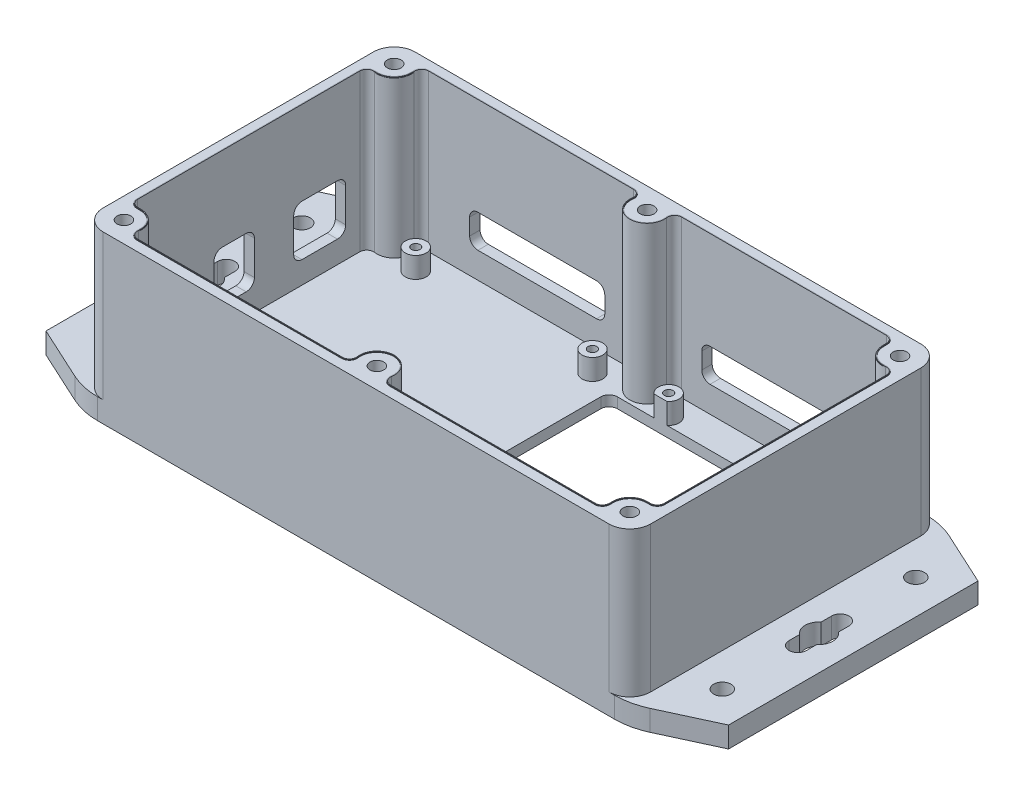
from build123d import *

# Parameters (mm, degrees)
SKETCH1_W           = 158
SKETCH1_H           = 90
BOSS_EXTRUDE1_DEPTH = 48
BOSS_EXTRUDE2_DEPTH = 6
HOLE2_D             = 5
CUT_EXTRUDE1_DEPTH  = 187.622613849
SHELL1_START        = 3
SHELL1_OUTLINE_W    = 45
SHELL1_OUTLINE_H    = 84
SHELL1_DEPTH        = 152
SKETCH7_R           = 5
BOSS_EXTRUDE3_DEPTH = 45
HOLE1_D             = 4
HOLE1_CBORE_D       = 7.5
HOLE1_CBORE_DEPTH   = 42
FILLET3_R           = 2
EXTRUDE_THIN1_DEPTH = 0.2
SKETCH12_R          = 3
BOSS_EXTRUDE4_DEPTH = 6
HOLE3_D             = 2.5
HOLE3_DEPTH         = 6
FILLET1_R           = 6
FILLET2_R           = 20
CUT_EXTRUDE2_REACH  = 206.767
SKETCH15_W          = 80.645
SKETCH15_H          = 53.25
FILLET4_R           = 2.38125
CUT_EXTRUDE3_REACH  = 206.767
SKETCH16_W          = 15
SKETCH16_H          = 14.6
SKETCH16_W_2        = 11.65
SKETCH16_W_3        = 9
SKETCH16_H_2        = 12.1
FILLET5_R           = 2.38125
CUT_EXTRUDE4_REACH  = 206.767
SKETCH17_W          = 46
SKETCH17_H          = 9.5
SKETCH17_W_2        = 39
FILLET6_R           = 2.38125


# Read off the part's stored shape, not the designer's step: Shell1
with BuildPart() as part:
    # Sketch1 → Boss-Extrude1 (new body)
    with BuildSketch(Plane(origin=(0, 0, 0), x_dir=(1, 0, 0), z_dir=(0, 1, 0))):
        with Locations((79, 45)):
            Rectangle(SKETCH1_W, SKETCH1_H)
    extrude(amount=BOSS_EXTRUDE1_DEPTH)

    # Sketch2 → Boss-Extrude2 (add)
    with BuildSketch(Plane.XZ):
        Polygon((-19.5, -9), (0, 0), (0, -90), (-19.5, -81), align=None)
    boss_extrude2 = extrude(amount=-BOSS_EXTRUDE2_DEPTH)

    # Hole2 (through all)
    with Locations(Plane(origin=(0, 6, 0), x_dir=(1, 0, 0), z_dir=(0, 1, 0))):
        with Locations((-9.62, 72.925), (-9.62, 17.075)):
            hole2 = Hole(HOLE2_D / 2)

    # Sketch10 → Cut-Extrude1 (cut, through all)
    with BuildSketch(Plane(origin=(0, 6, 0), x_dir=(1, 0, 0), z_dir=(0, 1, 0))):
        with BuildLine():
            Line((-12.12, 51.15), (-12.12, 48.122498999))
            ThreePointArc((-12.12, 48.122498999), (-13.62, 45), (-12.12, 41.877501001))
            Line((-12.12, 41.877501001), (-12.12, 38.85))
            ThreePointArc((-12.12, 38.85), (-9.62, 36.35), (-7.12, 38.85))
            Line((-7.12, 38.85), (-7.12, 41.877501001))
            ThreePointArc((-7.12, 41.877501001), (-5.62, 45), (-7.12, 48.122498999))
            Line((-7.12, 48.122498999), (-7.12, 51.15))
            ThreePointArc((-7.12, 51.15), (-9.62, 53.65), (-12.12, 51.15))
        make_face()
    cut_extrude1 = extrude(amount=-CUT_EXTRUDE1_DEPTH, mode=Mode.SUBTRACT)

    # Shell1 outline → Shell1 (cut)
    with BuildSketch(Plane.YZ.offset(SHELL1_START)):
        with Locations((25.5, -45)):
            Rectangle(SHELL1_OUTLINE_W, SHELL1_OUTLINE_H)
    extrude(amount=SHELL1_DEPTH, mode=Mode.SUBTRACT)

    # Sketch7 → Boss-Extrude3 (add)
    with BuildSketch(Plane(origin=(0, 3, 0), x_dir=(1, 0, 0), z_dir=(0, 1, 0))):
        with Locations((79, 84)):
            Circle(SKETCH7_R)
        with Locations((6, 84)):
            Circle(SKETCH7_R)
        with Locations((6, 6)):
            Circle(SKETCH7_R)
        with Locations((79, 6)):
            Circle(SKETCH7_R)
        with Locations((152, 6)):
            Circle(SKETCH7_R)
        with Locations((152, 84)):
            Circle(SKETCH7_R)
    extrude(amount=BOSS_EXTRUDE3_DEPTH)

    # Mirror1: Boss-Extrude2, Hole2, Cut-Extrude1 across plane
    add(boss_extrude2.mirror(Plane(origin=(79, 0, 0), x_dir=(0, 0, 1), z_dir=(1, 0, 0))))
    add(hole2.mirror(Plane(origin=(79, 0, 0), x_dir=(0, 0, 1), z_dir=(1, 0, 0))), mode=Mode.SUBTRACT)
    add(cut_extrude1.mirror(Plane(origin=(79, 0, 0), x_dir=(0, 0, 1), z_dir=(1, 0, 0))), mode=Mode.SUBTRACT)

    # Hole1 (through all)
    with Locations(Plane(origin=(0, 0, 0), x_dir=(-1, 0, 0), z_dir=(0, -1, 0))):
        with Locations((-152, 84), (-152, 6), (-79, 84), (-79, 6), (-6, 84), (-6, 6)):
            CounterBoreHole(HOLE1_D / 2, HOLE1_CBORE_D / 2, HOLE1_CBORE_DEPTH)

    # Fillet3
    fillet3_edges = [part.edges().sort_by_distance(p)[0] for p in [
        (3, 25.5, -80),
        (10, 25.5, -87),
        (10, 25.5, -3),
        (3, 25.5, -10),
        (83, 25.5, -3),
        (75, 25.5, -3),
        (155, 25.5, -10),
        (148, 25.5, -3),
        (155, 25.5, -80),
        (148, 25.5, -87),
        (75, 25.5, -87),
        (83, 25.5, -87),
    ]]
    fillet(fillet3_edges, radius=FILLET3_R)

    # Sketch11 → Extrude-Thin1 (add)
    with BuildSketch(Plane(origin=(0, 48, 0), x_dir=(1, 0, 0), z_dir=(0, 1, 0))):
        with BuildLine():
            ThreePointArc((83.750767929, 5.314285714), (79, 10.8), (74.249232071, 5.314285714))
            ThreePointArc((74.249232071, 5.314285714), (73.734840451, 3.559761924), (72.07179677, 2.8))
            Line((72.07179677, 2.8), (12.92820323, 2.8))
            ThreePointArc((12.92820323, 2.8), (11.372568312, 3.444365081), (10.72820323, 5))
            Line((10.72820323, 5), (10.72820323, 5.92820323))
            ThreePointArc((10.72820323, 5.92820323), (9.32231578, 9.32231578), (5.92820323, 10.72820323))
            Line((5.92820323, 10.72820323), (5, 10.72820323))
            ThreePointArc((5, 10.72820323), (3.444365081, 11.372568312), (2.8, 12.92820323))
            Line((2.8, 12.92820323), (2.8, 77.07179677))
            ThreePointArc((2.8, 77.07179677), (3.444365081, 78.627431688), (5, 79.27179677))
            Line((5, 79.27179677), (5.92820323, 79.27179677))
            ThreePointArc((5.92820323, 79.27179677), (9.32231578, 80.67768422), (10.72820323, 84.07179677))
            Line((10.72820323, 84.07179677), (10.72820323, 85))
            ThreePointArc((10.72820323, 85), (11.372568312, 86.555634919), (12.92820323, 87.2))
            Line((12.92820323, 87.2), (72.07179677, 87.2))
            ThreePointArc((72.07179677, 87.2), (73.734840451, 86.440238076), (74.249232071, 84.685714286))
            ThreePointArc((74.249232071, 84.685714286), (79, 79.2), (83.750767929, 84.685714286))
            ThreePointArc((83.750767929, 84.685714286), (84.265159549, 86.440238076), (85.92820323, 87.2))
            Line((85.92820323, 87.2), (145.07179677, 87.2))
            ThreePointArc((145.07179677, 87.2), (146.627431688, 86.555634919), (147.27179677, 85))
            Line((147.27179677, 85), (147.27179677, 84.07179677))
            ThreePointArc((147.27179677, 84.07179677), (148.67768422, 80.67768422), (152.07179677, 79.27179677))
            Line((152.07179677, 79.27179677), (153, 79.27179677))
            ThreePointArc((153, 79.27179677), (154.555634919, 78.627431688), (155.2, 77.07179677))
            Line((155.2, 77.07179677), (155.2, 12.92820323))
            ThreePointArc((155.2, 12.92820323), (154.555634919, 11.372568312), (153, 10.72820323))
            Line((153, 10.72820323), (152.07179677, 10.72820323))
            ThreePointArc((152.07179677, 10.72820323), (148.67768422, 9.32231578), (147.27179677, 5.92820323))
            Line((147.27179677, 5.92820323), (147.27179677, 5))
            ThreePointArc((147.27179677, 5), (146.627431688, 3.444365081), (145.07179677, 2.8))
            Line((145.07179677, 2.8), (85.92820323, 2.8))
            ThreePointArc((85.92820323, 2.8), (84.265159549, 3.559761924), (83.750767929, 5.314285714))
        make_face()
        with BuildLine():
            ThreePointArc((83.948716593, 5.285714286), (79, 11), (74.051283407, 5.285714286))
            ThreePointArc((74.051283407, 5.285714286), (73.583654662, 3.690692659), (72.07179677, 3))
            Line((72.07179677, 3), (12.92820323, 3))
            ThreePointArc((12.92820323, 3), (11.513989668, 3.585786438), (10.92820323, 5))
            Line((10.92820323, 5), (10.92820323, 5.92820323))
            ThreePointArc((10.92820323, 5.92820323), (9.463737136, 9.463737136), (5.92820323, 10.92820323))
            Line((5.92820323, 10.92820323), (5, 10.92820323))
            ThreePointArc((5, 10.92820323), (3.585786438, 11.513989668), (3, 12.92820323))
            Line((3, 12.92820323), (3, 77.07179677))
            ThreePointArc((3, 77.07179677), (3.585786438, 78.486010332), (5, 79.07179677))
            Line((5, 79.07179677), (5.92820323, 79.07179677))
            ThreePointArc((5.92820323, 79.07179677), (9.463737136, 80.536262864), (10.92820323, 84.07179677))
            Line((10.92820323, 84.07179677), (10.92820323, 85))
            ThreePointArc((10.92820323, 85), (11.513989668, 86.414213562), (12.92820323, 87))
            Line((12.92820323, 87), (72.07179677, 87))
            ThreePointArc((72.07179677, 87), (73.583654662, 86.309307341), (74.051283407, 84.714285714))
            ThreePointArc((74.051283407, 84.714285714), (79, 79), (83.948716593, 84.714285714))
            ThreePointArc((83.948716593, 84.714285714), (84.416345338, 86.309307341), (85.92820323, 87))
            Line((85.92820323, 87), (145.07179677, 87))
            ThreePointArc((145.07179677, 87), (146.486010332, 86.414213562), (147.07179677, 85))
            Line((147.07179677, 85), (147.07179677, 84.07179677))
            ThreePointArc((147.07179677, 84.07179677), (148.536262864, 80.536262864), (152.07179677, 79.07179677))
            Line((152.07179677, 79.07179677), (153, 79.07179677))
            ThreePointArc((153, 79.07179677), (154.414213562, 78.486010332), (155, 77.07179677))
            Line((155, 77.07179677), (155, 12.92820323))
            ThreePointArc((155, 12.92820323), (154.414213562, 11.513989668), (153, 10.92820323))
            Line((153, 10.92820323), (152.07179677, 10.92820323))
            ThreePointArc((152.07179677, 10.92820323), (148.536262864, 9.463737136), (147.07179677, 5.92820323))
            Line((147.07179677, 5.92820323), (147.07179677, 5))
            ThreePointArc((147.07179677, 5), (146.486010332, 3.585786438), (145.07179677, 3))
            Line((145.07179677, 3), (85.92820323, 3))
            ThreePointArc((85.92820323, 3), (84.416345338, 3.690692659), (83.948716593, 5.285714286))
        make_face(mode=Mode.SUBTRACT)
    extrude(amount=EXTRUDE_THIN1_DEPTH)

    # Sketch12 → Boss-Extrude4 (add)
    with BuildSketch(Plane(origin=(0, 3, 0), x_dir=(1, 0, 0), z_dir=(0, 1, 0))):
        with Locations(Location((15.87241909, 80.35, 0), (0, 0, 90))):
            Circle(SKETCH12_R)
        with Locations(Location((66.87241909, 80.35, 0), (0, 0, 90))):
            Circle(SKETCH12_R)
        with Locations(Location((140.62241909, 80.35, 0), (0, 0, 90))):
            Circle(SKETCH12_R)
        with Locations(Location((88.87241909, 80.35, 0), (0, 0, 90))):
            Circle(SKETCH12_R)
        with Locations(Location((66.87241909, 9.65, 0), (0, 0, 90))):
            Circle(SKETCH12_R)
        with Locations(Location((15.87241909, 9.65, 0), (0, 0, 90))):
            Circle(SKETCH12_R)
        with Locations(Location((88.87241909, 9.65, 0), (0, 0, 90))):
            Circle(SKETCH12_R)
        with Locations(Location((140.62241909, 9.65, 0), (0, 0, 90))):
            Circle(SKETCH12_R)
        with Locations(Location((93.060693078, 19.233989691, 0), (0, 0, 90))):
            Circle(SKETCH12_R)
        with Locations(Location((133.760693078, 19.233989691, 0), (0, 0, 90))):
            Circle(SKETCH12_R)
    extrude(amount=BOSS_EXTRUDE4_DEPTH)

    # Hole3
    with Locations(Plane(origin=(0, 9, 0), x_dir=(1, 0, 0), z_dir=(0, 1, 0))):
        with Locations((15.87241909, 80.35), (66.87241909, 80.35), (88.87241909, 80.35), (140.62241909, 80.35), (133.760693078, 19.233989691), (93.060693078, 19.233989691), (140.62241909, 9.65), (88.87241909, 9.65), (66.87241909, 9.65), (15.87241909, 9.65)):
            Hole(HOLE3_D / 2, depth=HOLE3_DEPTH)

    # Fillet1
    fillet1_edges = [part.edges().sort_by_distance(p)[0] for p in [
        (0, 27, 0),
        (0, 27, -90),
        (158, 27, 0),
        (158, 27, -90),
    ]]
    fillet(fillet1_edges, radius=FILLET1_R)

    # Fillet2
    fillet2_edges = [part.edges().sort_by_distance(p)[0] for p in [
        (158, 3, -90),
        (158, 3, 0),
        (0, 3, -90),
        (0, 3, 0),
    ]]
    fillet(fillet2_edges, radius=FILLET2_R)

    # Sketch15 → Cut-Extrude2 (cut, up to next)
    with BuildSketch(Plane.XZ, mode=Mode.PRIVATE) as cut_extrude2_sk1:
        with Locations((114.34, -51.375)):
            Rectangle(SKETCH15_W, SKETCH15_H)
    cut_extrude2_tool1 = extrude(cut_extrude2_sk1.sketch, amount=-CUT_EXTRUDE2_REACH, mode=Mode.PRIVATE) & part.part
    add(cut_extrude2_tool1.solids().sort_by_distance((114.34, 0, -51.375))[0], mode=Mode.SUBTRACT)

    # Fillet4
    fillet4_edges = [part.edges().sort_by_distance(p)[0] for p in [
        (74.0175, 1.5, -78),
        (74.0175, 1.5, -24.75),
        (154.6625, 1.5, -24.75),
        (154.6625, 1.5, -78),
    ]]
    fillet(fillet4_edges, radius=FILLET4_R)

    # Sketch16 → Cut-Extrude3 (cut, up to next)
    with BuildSketch(Plane.ZY, mode=Mode.PRIVATE) as cut_extrude3_sk1:
        with Locations((-65.5, 16.7)):
            Rectangle(SKETCH16_W, SKETCH16_H)
    cut_extrude3_tool1 = extrude(cut_extrude3_sk1.sketch, amount=-CUT_EXTRUDE3_REACH, mode=Mode.PRIVATE) & part.part
    # Sketch16 → Cut-Extrude3 (cut, up to next)
    with BuildSketch(Plane.ZY, mode=Mode.PRIVATE) as cut_extrude3_sk2:
        with Locations((-40.825, 16.7)):
            Rectangle(SKETCH16_W_2, SKETCH16_H)
    cut_extrude3_tool2 = extrude(cut_extrude3_sk2.sketch, amount=-CUT_EXTRUDE3_REACH, mode=Mode.PRIVATE) & part.part
    # Sketch16 → Cut-Extrude3 (cut, up to next)
    with BuildSketch(Plane.ZY, mode=Mode.PRIVATE) as cut_extrude3_sk3:
        with Locations((-23.9, 15.45)):
            Rectangle(SKETCH16_W_3, SKETCH16_H_2)
    cut_extrude3_tool3 = extrude(cut_extrude3_sk3.sketch, amount=-CUT_EXTRUDE3_REACH, mode=Mode.PRIVATE) & part.part
    add(cut_extrude3_tool1.solids().sort_by_distance((0, 16.7, -65.5))[0], mode=Mode.SUBTRACT)
    add(cut_extrude3_tool2.solids().sort_by_distance((0, 16.7, -40.825))[0], mode=Mode.SUBTRACT)
    add(cut_extrude3_tool3.solids().sort_by_distance((0, 15.45, -23.9))[0], mode=Mode.SUBTRACT)

    # Fillet5
    fillet5_edges = [part.edges().sort_by_distance(p)[0] for p in [
        (1.5, 9.4, -58),
        (1.5, 24, -58),
        (1.5, 24, -73),
        (1.5, 9.4, -73),
        (1.5, 9.4, -35),
        (1.5, 24, -35),
        (1.5, 24, -46.65),
        (1.5, 9.4, -46.65),
        (1.5, 9.4, -19.4),
        (1.5, 21.5, -19.4),
        (1.5, 21.5, -28.4),
        (1.5, 9.4, -28.4),
    ]]
    fillet(fillet5_edges, radius=FILLET5_R)

    # Sketch17 → Cut-Extrude4 (cut, up to next)
    with BuildSketch(Plane(origin=(0, 0, -90), x_dir=(-1, 0, 0), z_dir=(0, 0, -1)), mode=Mode.PRIVATE) as cut_extrude4_sk1:
        with Locations((-114.78, 15.25)):
            Rectangle(SKETCH17_W, SKETCH17_H)
    cut_extrude4_tool1 = extrude(cut_extrude4_sk1.sketch, amount=-CUT_EXTRUDE4_REACH, mode=Mode.PRIVATE) & part.part
    # Sketch17 → Cut-Extrude4 (cut, up to next)
    with BuildSketch(Plane(origin=(0, 0, -90), x_dir=(-1, 0, 0), z_dir=(0, 0, -1)), mode=Mode.PRIVATE) as cut_extrude4_sk2:
        with Locations((-44.28, 15.25)):
            Rectangle(SKETCH17_W_2, SKETCH17_H)
    cut_extrude4_tool2 = extrude(cut_extrude4_sk2.sketch, amount=-CUT_EXTRUDE4_REACH, mode=Mode.PRIVATE) & part.part
    add(cut_extrude4_tool1.solids().sort_by_distance((114.78, 15.25, -90))[0], mode=Mode.SUBTRACT)
    add(cut_extrude4_tool2.solids().sort_by_distance((44.28, 15.25, -90))[0], mode=Mode.SUBTRACT)

    # Fillet6
    fillet6_edges = [part.edges().sort_by_distance(p)[0] for p in [
        (91.78, 10.5, -88.5),
        (91.78, 20, -88.5),
        (137.78, 20, -88.5),
        (137.78, 10.5, -88.5),
        (24.78, 10.5, -88.5),
        (24.78, 20, -88.5),
        (63.78, 20, -88.5),
        (63.78, 10.5, -88.5),
    ]]
    fillet(fillet6_edges, radius=FILLET6_R)


solid = part.part
